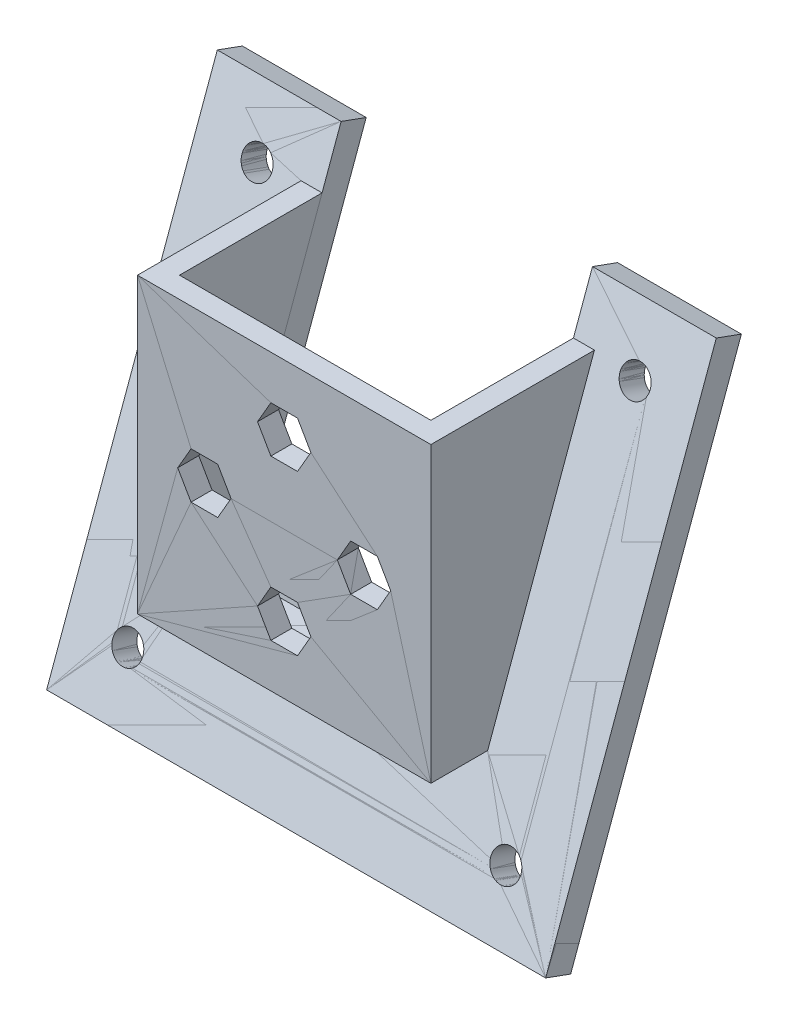
from build123d import *

# Parameters (mm, degrees)
SKETCH5_W           = 59.399999564
SKETCH5_H           = 59.399999564
BOSS_EXTRUDE3_DEPTH = 3.175
BOSS_EXTRUDE4_REACH = 52.952
SKETCH1_W           = 34.925
SKETCH1_H           = 34.925
SKETCH5_5_R         = 1.799999956
CUT_EXTRUDE5_DEPTH  = 44.987110755
SHELL1_T            = -2.5
SKETCH8_R           = 1.56250005
CUT_EXTRUDE4_DEPTH  = 2.5
SKETCH10_W          = 10
SKETCH10_H          = 6
CUT_EXTRUDE7_DEPTH  = 3.175
CUT_EXTRUDE9_DEPTH  = 2.5
SKETCH16_W          = 29.925
SKETCH16_H          = 41.137726754
CUT_EXTRUDE11_DEPTH = 44.537192462


# Read off the part's stored shape, not the designer's step: Split1
with BuildPart() as part:
    # Sketch5 → Boss-Extrude3 (new body)
    with BuildSketch(Plane(origin=(0, -5.300466321, -14.56291153), x_dir=(1, 0, 0), z_dir=(0, 0.3420201433256694, 0.9396926207859082))):
        Rectangle(SKETCH5_W, SKETCH5_H)
    extrude(amount=BOSS_EXTRUDE3_DEPTH)

    # Boss-Extrude4: up to this plane
    boss_extrude4_end = Plane(origin=(0, -4.214552366, -11.579387459), z_dir=(0, 0.34202014332566943, 0.9396926207859083))
    # Sketch1 → Boss-Extrude4 (add, up to the surface)
    with BuildSketch(Plane.XY, mode=Mode.PRIVATE) as boss_extrude4_sk1:
        Rectangle(SKETCH1_W, SKETCH1_H)
    boss_extrude4_tool1 = split(extrude(boss_extrude4_sk1.sketch, amount=-BOSS_EXTRUDE4_REACH, mode=Mode.PRIVATE), bisect_by=boss_extrude4_end, keep=Keep.BOTH, mode=Mode.PRIVATE)
    add(boss_extrude4_tool1.solids().sort_by_distance((0, 0, 0))[0])

    # Sketch5<5> → Cut-Extrude5 (cut, through all)
    with BuildSketch(Plane(origin=(0, -5.300466321, -14.56291153), x_dir=(1, 0, 0), z_dir=(0, 0.3420201433256694, 0.9396926207859082))):
        with Locations(Location((-22.499999958, -22.499999958, 0), (0, 0, 270))):
            Circle(SKETCH5_5_R)
        with Locations(Location((-22.499999958, 22.499999958, 0), (0, 0, 270))):
            Circle(SKETCH5_5_R)
        with Locations(Location((22.499999958, 22.499999958, 0), (0, 0, 270))):
            Circle(SKETCH5_5_R)
        with Locations(Location((22.499999958, -22.499999958, 0), (0, 0, 270))):
            Circle(SKETCH5_5_R)
    extrude(amount=CUT_EXTRUDE5_DEPTH, mode=Mode.SUBTRACT)


with BuildPart() as body_2:
    # Split1: the piece on the far side of the plane
    add(part.part)
    split(bisect_by=Plane(origin=(0, -4.214552366, -11.579387459), x_dir=(1, 0, 0), z_dir=(0, 0.3420201433256691, 0.9396926207859083)), keep=Keep.BOTTOM)


with BuildPart() as part_1:
    add(part.part)

    # Split1
    split(bisect_by=Plane(origin=(0, -4.214552366, -11.579387459), x_dir=(1, 0, 0), z_dir=(0, 0.3420201433256691, 0.9396926207859083)), keep=Keep.TOP)

    # Shell1
    shell1_openings = [part_1.faces().sort_by_distance(p)[0] for p in [
        (0, 17.4625, -9.734594643),
        (0, 0, -13.113359071),
    ]]
    offset(amount=SHELL1_T, openings=shell1_openings, kind=Kind.INTERSECTION)

    # Sketch8 → Cut-Extrude4 (cut)
    with BuildSketch(Plane.XY):
        with Locations((0, 9.50000005)):
            Circle(SKETCH8_R)
        with Locations((9.50000005, 0)):
            Circle(SKETCH8_R)
        with Locations((0, -9.50000005)):
            Circle(SKETCH8_R)
        with Locations((-9.50000005, 0)):
            Circle(SKETCH8_R)
    extrude(amount=-CUT_EXTRUDE4_DEPTH, mode=Mode.SUBTRACT)

    # Combine1: union body 2
    add(body_2.part)


with BuildPart() as body_2_2:
    # Mirror4: mirrored copy
    add(part_1.part.mirror(Plane(origin=(0, 0, 0), x_dir=(0, 0, 1), z_dir=(1, 0, 0))))


with BuildPart() as cut_extrude7_tool:
    # Sketch10 → Cut-Extrude7 (new body)
    with BuildSketch(Plane(origin=(0, -5.300466321, -14.56291153), x_dir=(-1, 0, 0), z_dir=(0, -0.3420201433256695, -0.9396926207859082))):
        with Locations((4, 11)):
            Rectangle(SKETCH10_W, SKETCH10_H)
    extrude(amount=-CUT_EXTRUDE7_DEPTH)


with BuildPart() as part_2:
    add(part_1.part)

    # Cut-Extrude7: cut by cut_extrude7_tool
    add(cut_extrude7_tool.part, mode=Mode.SUBTRACT)


with BuildPart() as body_2_2_1:
    add(body_2_2.part)

    # Cut-Extrude7: cut by cut_extrude7_tool
    add(cut_extrude7_tool.part, mode=Mode.SUBTRACT)


with BuildPart() as cut_extrude9_tool:
    # Sketch11 → Cut-Extrude9 (new body)
    with BuildSketch(Plane.XY):
        Polygon((1.5875, 12.249630707), (-1.5875, 12.249630707), (-3.175, 9.50000005), (-1.5875, 6.750369393), (1.5875, 6.750369393), (3.175, 9.50000005), align=None)
        Polygon((11.08750005, 2.749630657), (7.91250005, 2.749630657), (6.32500005, 0), (7.91250005, -2.749630657), (11.08750005, -2.749630657), (12.67500005, 0), align=None)
        Polygon((1.5875, -6.750369393), (-1.5875, -6.750369393), (-3.175, -9.50000005), (-1.5875, -12.249630707), (1.5875, -12.249630707), (3.175, -9.50000005), align=None)
        Polygon((-7.91250005, 2.749630657), (-11.08750005, 2.749630657), (-12.67500005, 0), (-11.08750005, -2.749630657), (-7.91250005, -2.749630657), (-6.32500005, 0), align=None)
    extrude(amount=-CUT_EXTRUDE9_DEPTH)


with BuildPart() as part_3:
    add(part_2.part)

    # Cut-Extrude9: cut by cut_extrude9_tool
    add(cut_extrude9_tool.part, mode=Mode.SUBTRACT)


with BuildPart() as body_2_2_2:
    add(body_2_2_1.part)

    # Cut-Extrude9: cut by cut_extrude9_tool
    add(cut_extrude9_tool.part, mode=Mode.SUBTRACT)


with BuildPart() as cut_extrude11_tool:
    # Sketch16 → Cut-Extrude11 (new, through all)
    with BuildSketch(Plane(origin=(0, -4.214552366, -11.579387459), x_dir=(1, 0, 0), z_dir=(0, 0.34202014332566943, 0.9396926207859083))):
        with Locations((0, 9.131136405)):
            Rectangle(SKETCH16_W, SKETCH16_H)
    extrude(amount=-CUT_EXTRUDE11_DEPTH)


with BuildPart() as part_4:
    add(part_3.part)

    # Cut-Extrude11: cut by cut_extrude11_tool
    add(cut_extrude11_tool.part, mode=Mode.SUBTRACT)


with BuildPart() as body_2_2_3:
    add(body_2_2_2.part)

    # Cut-Extrude11: cut by cut_extrude11_tool
    add(cut_extrude11_tool.part, mode=Mode.SUBTRACT)


solid = Compound([part_4.part, body_2_2_3.part])
